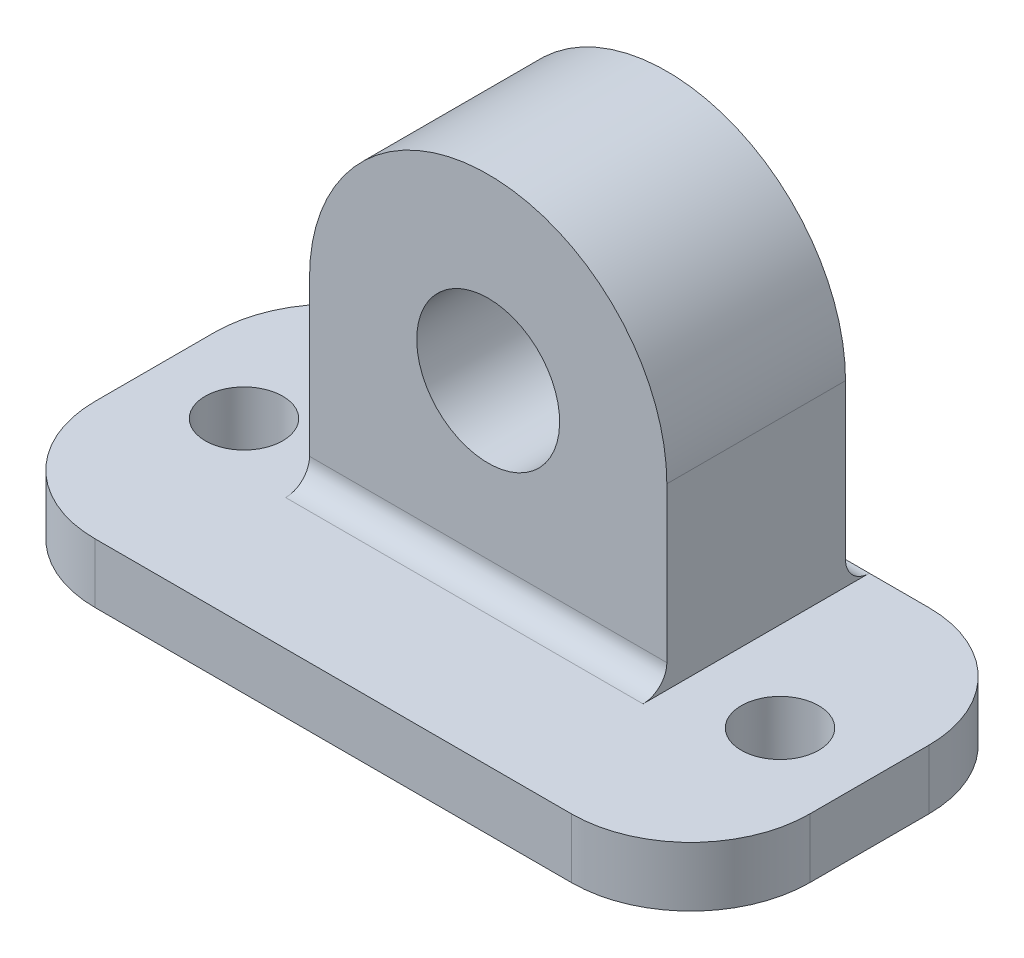
from build123d import *

# Parameters (mm, degrees)
SKETCH_1_R          = 6
EXTRUDE_1_DEPTH     = 30
SKETCH_2_W          = 13
SKETCH_2_H          = 30
SKETCH_2_W_2        = 2
CUT_EXTRUDE_1_DEPTH = 15
SKETCH_3_R          = 3.25
CUT_EXTRUDE_2_DEPTH = 15
FILLET_1_R          = 2
FILLET_2_R          = 10


with BuildPart() as part:
    # 草图1 → 凸台-拉伸1 (new body)
    with BuildSketch(Plane.XY):
        with BuildLine():
            Line((-30, 1.666666667), (-15, 1.666666667))
            Line((-15, 1.666666667), (-15, 16.666666667))
            ThreePointArc((-15, 16.666666667), (0, 31.666666667), (15, 16.666666667))
            Line((15, 16.666666667), (15, 1.666666667))
            Line((15, 1.666666667), (30, 1.666666667))
            Line((30, 1.666666667), (30, -3.333333333))
            Line((30, -3.333333333), (-30, -3.333333333))
            Line((-30, -3.333333333), (-30, 1.666666667))
        make_face()
        with Locations((0, 16.666666667)):
            Circle(SKETCH_1_R, mode=Mode.SUBTRACT)
    extrude(amount=EXTRUDE_1_DEPTH)

    # 草图2 → 切除-拉伸1 (cut, symmetric)
    with BuildSketch(Plane(origin=(0, 0, 0), x_dir=(0, 0, -1), z_dir=(1, 0, 0))):
        with Locations((-23.5, 16.666666667)):
            Rectangle(SKETCH_2_W, SKETCH_2_H)
        with Locations((-1, 16.666666667)):
            Rectangle(SKETCH_2_W_2, SKETCH_2_H)
    extrude(amount=CUT_EXTRUDE_1_DEPTH, both=True, mode=Mode.SUBTRACT)

    # 草图3 → 切除-拉伸2 (cut, symmetric)
    with BuildSketch(Plane(origin=(0, 0, 0), x_dir=(1, 0, 0), z_dir=(0, 1, 0))):
        with Locations((-22.5, -15)):
            Circle(SKETCH_3_R)
        with Locations((22.5, -15)):
            Circle(SKETCH_3_R)
    extrude(amount=CUT_EXTRUDE_2_DEPTH, both=True, mode=Mode.SUBTRACT)

    # 圆角1
    fillet_1_edges = [part.edges().sort_by_distance(p)[0] for p in [
        (0, 1.666666667, 17),
        (0, 1.666666667, 2),
    ]]
    fillet(fillet_1_edges, radius=FILLET_1_R - 0.0001)  # a hair under: the kernel refuses the full size

    # 圆角2
    fillet_2_edges = [part.edges().sort_by_distance(p)[0] for p in [
        (30, -0.833333333, 30),
        (-30, -0.833333333, 0),
        (-30, -0.833333333, 30),
        (30, -0.833333333, 0),
    ]]
    fillet(fillet_2_edges, radius=FILLET_2_R)


solid = part.part
